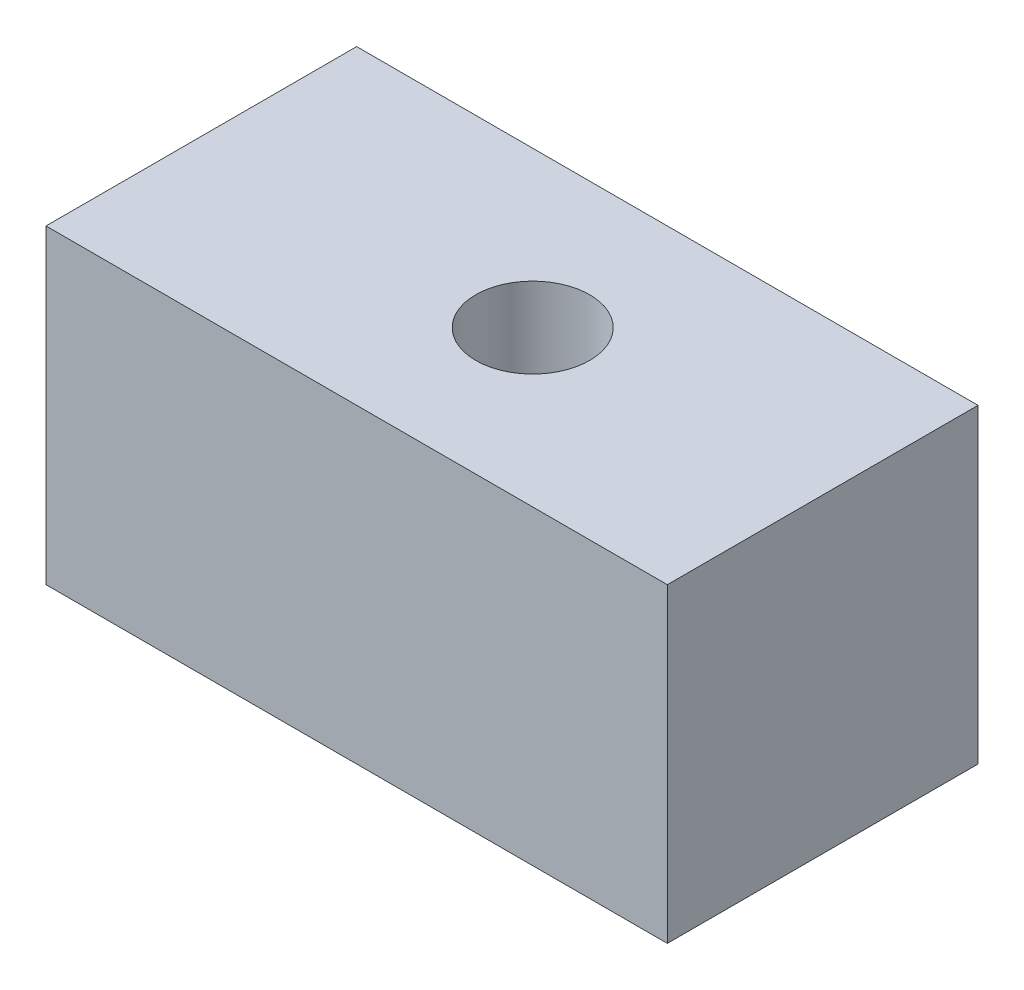
from build123d import *

# Parameters (mm, degrees)
SKETCH1_W           = 15
SKETCH1_H           = 15
BOSS_EXTRUDE1_DEPTH = 30
SKETCH2_R           = 2.75
CUT_EXTRUDE1_DEPTH  = 35.369317712
SKETCH3_W           = 10
SKETCH3_H           = 6.858
SKETCH3_R           = 1.5875
CUT_EXTRUDE2_DEPTH  = 1


with BuildPart() as part:
    # Sketch1 → Boss-Extrude1 (new body)
    with BuildSketch(Plane(origin=(0, 0, 0), x_dir=(0, 0, -1), z_dir=(1, 0, 0))):
        Rectangle(SKETCH1_W, SKETCH1_H)
    extrude(amount=BOSS_EXTRUDE1_DEPTH)

    # Sketch2 → Cut-Extrude1 (cut, through all)
    with BuildSketch(Plane(origin=(0, 7.5, 0), x_dir=(1, 0, 0), z_dir=(0, 1, 0))):
        with Locations((16, 0)):
            Circle(SKETCH2_R)
    extrude(amount=-CUT_EXTRUDE1_DEPTH, mode=Mode.SUBTRACT)

    # Sketch3 → Cut-Extrude2 (cut)
    with BuildSketch(Plane(origin=(0, 0, -7.5), x_dir=(-1, 0, 0), z_dir=(0, 0, -1))):
        with Locations((-5, 2.071)):
            Rectangle(SKETCH3_W, SKETCH3_H)
        with Locations((-4.92, 2.071)):
            Circle(SKETCH3_R, mode=Mode.SUBTRACT)
    extrude(amount=-CUT_EXTRUDE2_DEPTH, mode=Mode.SUBTRACT)


solid = part.part
